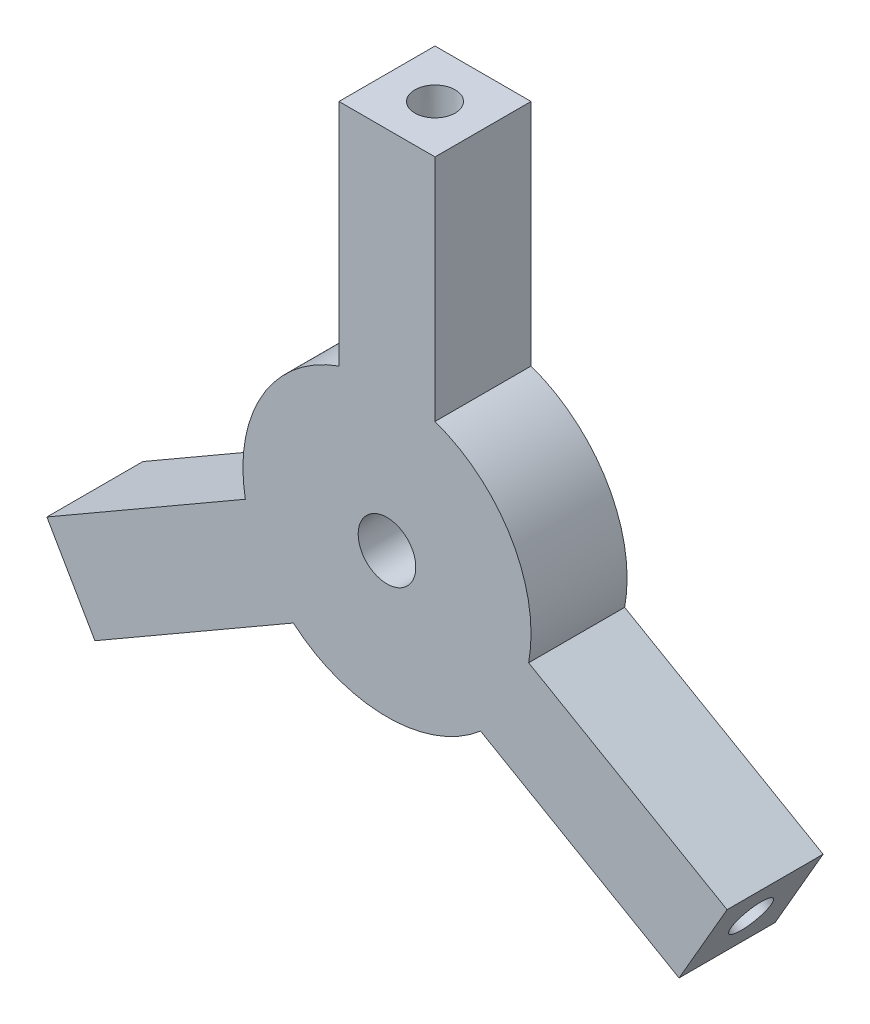
from build123d import *

# Parameters (mm, degrees)
BOSS_EXTRUDE1_DEPTH = 5
SKETCH2_R           = 1.05
CUT_EXTRUDE1_DEPTH  = 10
CIRPATTERN2_COUNT   = 3
DRAFT4_ANGLE        = 1
DRAFT5_ANGLE        = 1
DRAFT6_ANGLE        = 1
SKETCH3_R           = 1.5
CUT_EXTRUDE2_DEPTH  = 27.447092594


with BuildPart() as part:
    # Sketch1 → Boss-Extrude1 (new body)
    with BuildSketch(Plane.XY):
        with BuildLine():
            Line((4.873724357, -5.700597415), (15.204482672, -11.665063509))
            Line((15.204482672, -11.665063509), (17.704482672, -7.334936491))
            Line((17.704482672, -7.334936491), (7.373724357, -1.370470396))
            ThreePointArc((7.373724357, -1.370470396), (6.495190528, 3.75), (2.5, 7.071067812))
            Line((2.5, 7.071067812), (2.5, 19))
            Line((2.5, 19), (-2.5, 19))
            Line((-2.5, 19), (-2.5, 7.071067812))
            ThreePointArc((-2.5, 7.071067812), (-6.495190528, 3.75), (-7.373724357, -1.370470396))
            Line((-7.373724357, -1.370470396), (-17.704482672, -7.334936491))
            Line((-17.704482672, -7.334936491), (-15.204482672, -11.665063509))
            Line((-15.204482672, -11.665063509), (-4.873724357, -5.700597415))
            ThreePointArc((-4.873724357, -5.700597415), (0, -7.5), (4.873724357, -5.700597415))
        make_face()
    extrude(amount=BOSS_EXTRUDE1_DEPTH)

    # Sketch2 → Cut-Extrude1 (cut)
    with BuildSketch(Plane(origin=(0, 19, 0), x_dir=(1, 0, 0), z_dir=(0, 1, 0))):
        with Locations((0, -2.5)):
            Circle(SKETCH2_R)
    cut_extrude1 = extrude(amount=-CUT_EXTRUDE1_DEPTH, mode=Mode.SUBTRACT)

    # CirPattern2: Cut-Extrude1 ×3 about axis
    cirpattern2_axis = Axis((0, 0, 5), (0, 0, -1))
    for i in range(1, CIRPATTERN2_COUNT):
        add(cut_extrude1.rotate(cirpattern2_axis, i * 360 / CIRPATTERN2_COUNT), mode=Mode.SUBTRACT)

    # Draft4
    draft4_faces = [part.faces().sort_by_distance(p)[0] for p in [
        (-1.05, 14, 2.5),
    ]]
    draft(draft4_faces, Plane(origin=(-2.5, 19, 5), x_dir=(0, 0, 1), z_dir=(0, 1, 0)), DRAFT4_ANGLE)

    # Draft5
    draft5_faces = [part.faces().sort_by_distance(p)[0] for p in [
        (-11.599355653, -7.909326674, 2.5),
    ]]
    draft(draft5_faces, Plane(origin=(-17.704482672, -7.334936491, 5), x_dir=(0.4999999999999998, -0.8660254037844388, 0), z_dir=(-0.8660254037844388, -0.4999999999999998, 0)), DRAFT5_ANGLE)

    # Draft6
    draft6_faces = [part.faces().sort_by_distance(p)[0] for p in [
        (12.649355653, -6.090673326, 2.5),
    ]]
    draft(draft6_faces, Plane(origin=(15.204482672, -11.665063509, 5), x_dir=(0.4999999999999998, 0.8660254037844388, 0), z_dir=(0.8660254037844388, -0.4999999999999998, 0)), DRAFT6_ANGLE)

    # Sketch3 → Cut-Extrude2 (cut, through all)
    with BuildSketch(Plane(origin=(0, 0, 0), x_dir=(-1, 0, 0), z_dir=(0, 0, -1))):
        Circle(SKETCH3_R)
    extrude(amount=-CUT_EXTRUDE2_DEPTH, mode=Mode.SUBTRACT)


solid = part.part
